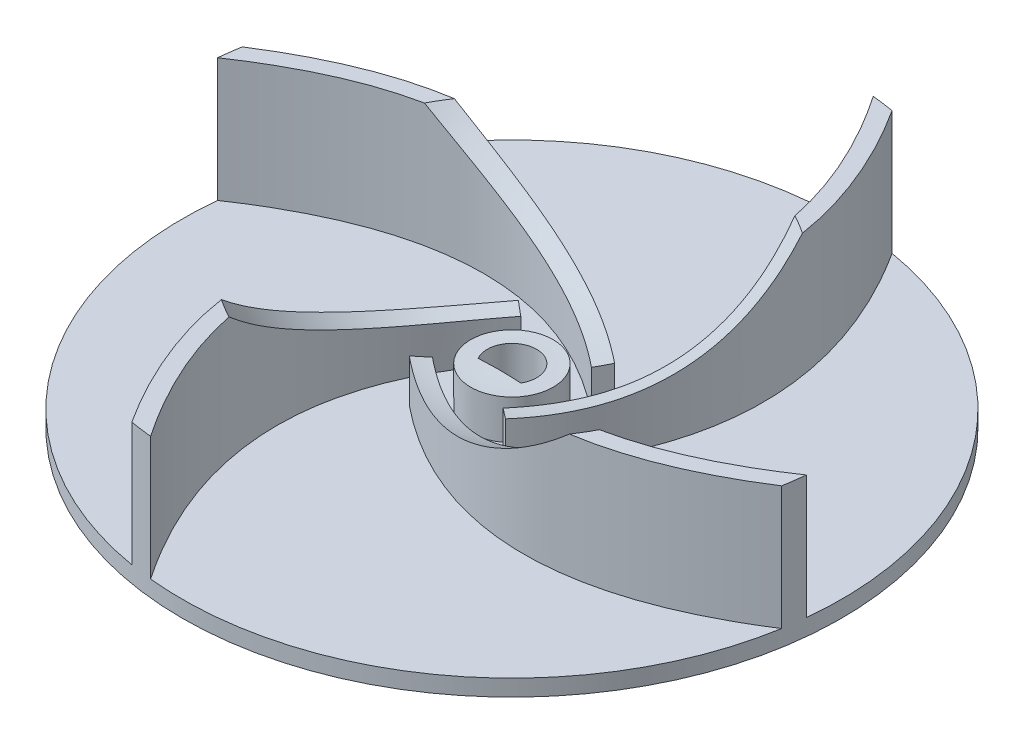
from build123d import *

# Parameters (mm, degrees)
SKETCH1_R           = 40
BOSS_EXTRUDE1_DEPTH = 2
SKETCH2_R           = 5
BOSS_EXTRUDE2_DEPTH = 7
CUT_EXTRUDE2_DEPTH  = 58
BOSS_EXTRUDE4_DEPTH = 15
CIRPATTERN1_COUNT   = 4


# Read off the part's stored shape, not the designer's step: Boss-Extrude4
with BuildPart() as part:
    # Sketch1 → Boss-Extrude1 (new body)
    with BuildSketch(Plane(origin=(0, 0, 0), x_dir=(1, 0, 0), z_dir=(0, 1, 0))):
        with Locations(Location((0, 0, 0), (0, 0, 270))):
            Circle(SKETCH1_R)
    extrude(amount=BOSS_EXTRUDE1_DEPTH)

    # Sketch2 → Boss-Extrude2 (add)
    with BuildSketch(Plane(origin=(0, 0, 0), x_dir=(1, 0, 0), z_dir=(0, 1, 0))):
        with Locations(Location((0, 0, 0), (0, 0, 270))):
            Circle(SKETCH2_R)
    extrude(amount=BOSS_EXTRUDE2_DEPTH)

    # Sketch4 → Cut-Extrude2 (cut, through all)
    with BuildSketch(Plane(origin=(0, 0, 0), x_dir=(1, 0, 0), z_dir=(0, 1, 0))):
        with BuildLine():
            Line((-2.598076211, -1.5), (2.598076211, -1.5))
            ThreePointArc((2.598076211, -1.5), (0, 3), (-2.598076211, -1.5))
        make_face()
    extrude(amount=CUT_EXTRUDE2_DEPTH, mode=Mode.SUBTRACT)

    # Boss-Extrude4 outline → Boss-Extrude4 (add)
    with BuildSketch(Plane(origin=(0, 2, 0), x_dir=(1, 0, 0), z_dir=(0, 1, 0))):
        with BuildLine():
            Line((5.360007285, 4.288004046), (6.620393902, 5.840880595))
            add(Edge.make_bspline(
                [(6.620393902, 5.840880595), (4.446591581, 7.60523936), (-2.240614046, 11.838382972), (-11.595270921, 14.60910996), (-21.325153615, 14.461577349), (-32.769869479, 10.987725064), (-39.434498844, 6.70226088)],
                knots=[0, 0, 0, 0.0625, 0.1875, 0.3125, 0.4375, 0.597789977, 0.597789977, 0.597789977], degree=2))
            ThreePointArc((-39.434498844, 6.70226088), (-39.635737327, 5.385937855), (-39.793049423, 4.063645853))
            add(Edge.make_bspline(
                [(5.360007285, 4.288004046), (3.271766893, 5.982916783), (-3.097296011, 10.009630326), (-11.871370928, 12.604159995), (-20.990596912, 12.469062744), (-32.556083101, 8.970033013), (-39.793049423, 4.063645853)],
                knots=[0, 0, 0, 0.0625, 0.1875, 0.3125, 0.4375, 0.615564575, 0.615564575, 0.615564575], degree=2))
        make_face()
    boss_extrude4 = extrude(amount=BOSS_EXTRUDE4_DEPTH)

    # CirPattern1: Boss-Extrude4 ×4 about axis
    cirpattern1_axis = Axis((0, 7, 0), (0, 1, 0))
    for i in range(1, CIRPATTERN1_COUNT):
        add(boss_extrude4.rotate(cirpattern1_axis, i * 360 / CIRPATTERN1_COUNT))

    # Sketch6 → Cut-Revolve1 (revolve, cut)
    with BuildSketch(Plane.XY, mode=Mode.PRIVATE) as cut_revolve1_sk:
        with BuildLine():
            Line((0, 7), (0, 17))
            Line((0, 17), (-25.416272602, 17))
            add(Edge.make_bspline(
                [(0, 7), (-15.082792744, 5.256181573), (-25.416272602, 17)],
                knots=[0, 0, 0, 1, 1, 1], degree=2))
        make_face()
    revolve(cut_revolve1_sk.sketch.rotate(Axis((0, 7, 0), (0, 1, 0)), 270), axis=Axis((0, 7, 0), (0, 1, 0)), mode=Mode.SUBTRACT)


solid = part.part
